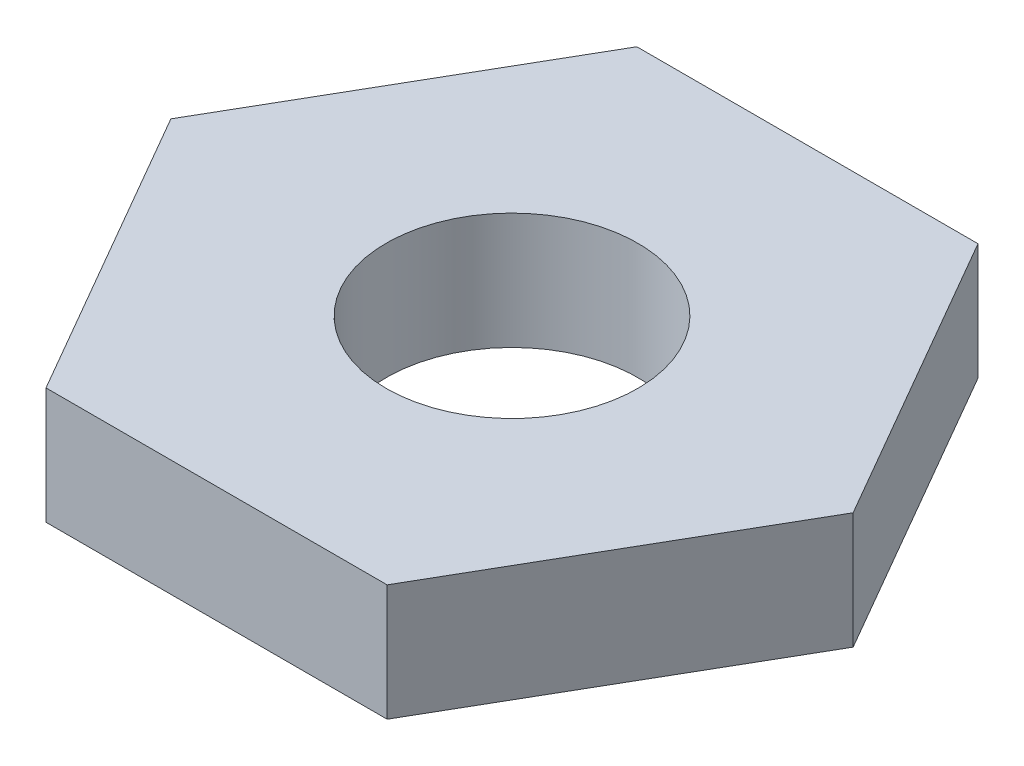
from build123d import *

# Parameters (mm, degrees)
SKETCH1_R           = 2
BOSS_EXTRUDE1_DEPTH = 1.85


with BuildPart() as part:
    # Sketch1 → Boss-Extrude1 (new body)
    with BuildSketch(Plane(origin=(0, 0, 0), x_dir=(1, 0, 0), z_dir=(0, 1, 0))):
        Polygon((5.422649728, 0), (2.711324864, 4.69615242), (-2.711324864, 4.69615242), (-5.422649728, 0), (-2.711324864, -4.69615242), (2.711324864, -4.69615242), align=None)
        Circle(SKETCH1_R, mode=Mode.SUBTRACT)
    extrude(amount=BOSS_EXTRUDE1_DEPTH)


solid = part.part
